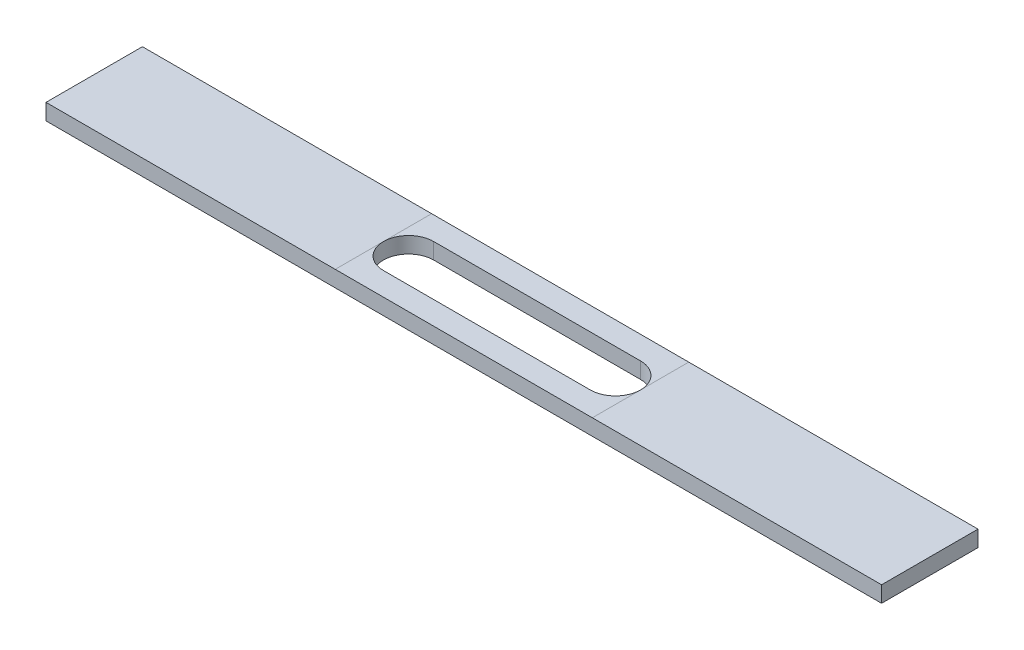
from build123d import *

# Parameters (mm, degrees)
SKETCH1_W           = 165.1
SKETCH1_H           = 19.05
BOSS_EXTRUDE1_DEPTH = 3.175
SLOT_DEPTH          = 84.158335421


with BuildPart() as part:
    # Sketch1 → Boss-Extrude1 (new body)
    with BuildSketch(Plane(origin=(0, 0, 0), x_dir=(1, 0, 0), z_dir=(0, 1, 0))):
        Rectangle(SKETCH1_W, SKETCH1_H)
    extrude(amount=BOSS_EXTRUDE1_DEPTH)

    # Sketch5 → Slot (cut, through all)
    with BuildSketch(Plane(origin=(0, 3.175, 0), x_dir=(1, 0, 0), z_dir=(0, 1, 0))):
        with BuildLine():
            Line((-20.4343, 4.9657), (20.4343, 4.9657))
            ThreePointArc((20.4343, 4.9657), (25.4, 0), (20.4343, -4.9657))
            Line((20.4343, -4.9657), (-20.4343, -4.9657))
            ThreePointArc((-20.4343, -4.9657), (-25.4, 0), (-20.4343, 4.9657))
        make_face()
    extrude(amount=-SLOT_DEPTH, mode=Mode.SUBTRACT)


solid = part.part
